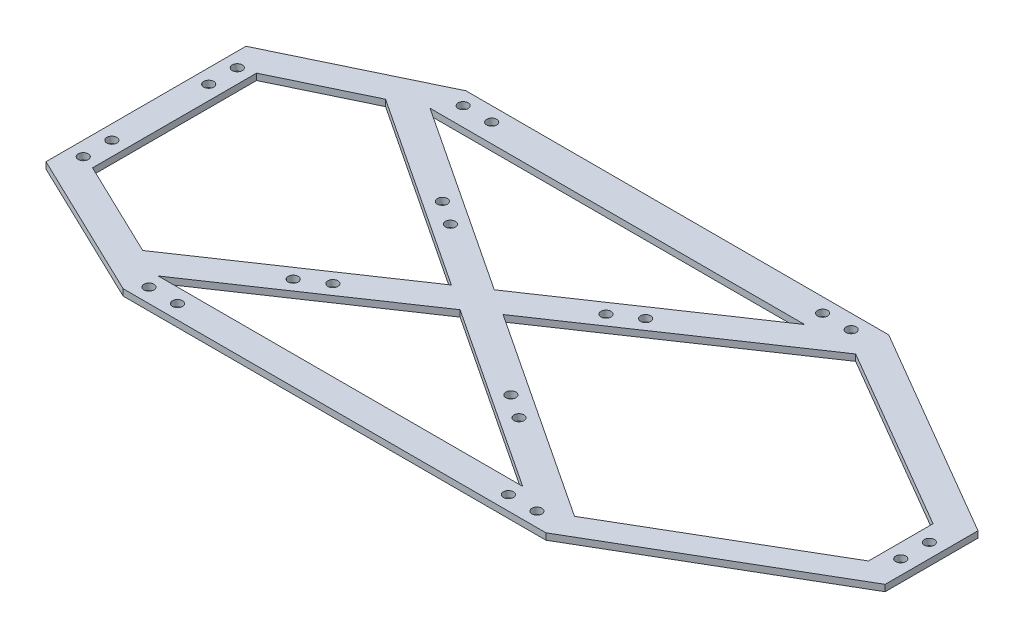
from build123d import *

# Parameters (mm, degrees)
BOSS_EXTRUDE3_DEPTH = 4.5
SKETCH2_R           = 3.5
CUT_EXTRUDE2_DEPTH  = 4.5
SKETCH3_R           = 3.5
CUT_EXTRUDE3_DEPTH  = 4.5
SKETCH4_R           = 3.5
CUT_EXTRUDE4_DEPTH  = 4.5
SKETCH5_R           = 3.5
CUT_EXTRUDE5_DEPTH  = 4.5
SKETCH6_R           = 3.5
CUT_EXTRUDE6_DEPTH  = 4.5
SKETCH7_R           = 3.5
CUT_EXTRUDE7_DEPTH  = 4.5
SKETCH8_R           = 3.5
CUT_EXTRUDE8_DEPTH  = 4.5
SKETCH9_R           = 3.5
CUT_EXTRUDE9_DEPTH  = 4.5


with BuildPart() as part:
    # Sketch1 → Boss-Extrude3 (new body)
    with BuildSketch(Plane(origin=(0, 0, 0), x_dir=(1, 0, 0), z_dir=(0, 1, 0))):
        Polygon((-400, 70), (-400, -70), (-296, -120), (0, -120), (150, -32.5), (150, 32.5), (0, 120), (-296, 120), align=None)
        Polygon((-298.002482939, 96.845926684), (-35.732646047, 96.845926684), (-165.408042798, 9.260497243), align=None, mode=Mode.SUBTRACT)
        Polygon((-380, 57.424043482), (-319.003928208, 86.749077997), (-183.349573846, -2.857581752), (-312.316233719, -89.964315732), (-380, -57.424043482), align=None, mode=Mode.SUBTRACT)
        Polygon((0, 96.845926684), (130, 21.012593351), (130, -24.166666667), (0, -100), (-147.342868955, -2.672476774), align=None, mode=Mode.SUBTRACT)
        Polygon((-36.286932906, -100), (-291.442010442, -100), (-165.284400003, -14.790555769), align=None, mode=Mode.SUBTRACT)
    extrude(amount=BOSS_EXTRUDE3_DEPTH)

    # Sketch2 → Cut-Extrude2 (cut)
    with BuildSketch(Plane(origin=(0, 4.5, 0), x_dir=(1, 0, 0), z_dir=(0, 1, 0))):
        with Locations((-36.286932906, -110)):
            Circle(SKETCH2_R)
        with Locations((-16.286932906, -110)):
            Circle(SKETCH2_R)
    cut_extrude2 = extrude(amount=-CUT_EXTRUDE2_DEPTH, mode=Mode.SUBTRACT)

    # Mirror1: Cut-Extrude2 across plane
    add(cut_extrude2.mirror(Plane.XY), mode=Mode.SUBTRACT)

    # Sketch3 → Cut-Extrude3 (cut)
    with BuildSketch(Plane(origin=(0, 4.5, 0), x_dir=(1, 0, 0), z_dir=(0, 1, 0))):
        with Locations((-267.942010442, -110)):
            Circle(SKETCH3_R)
        with Locations((-287.942010442, -110)):
            Circle(SKETCH3_R)
    cut_extrude3 = extrude(amount=-CUT_EXTRUDE3_DEPTH, mode=Mode.SUBTRACT)

    # Mirror2: Cut-Extrude3 across plane
    add(cut_extrude3.mirror(Plane.XY), mode=Mode.SUBTRACT)

    # Sketch4 → Cut-Extrude4 (cut)
    with BuildSketch(Plane(origin=(0, 4.5, 0), x_dir=(1, 0, 0), z_dir=(0, 1, 0))):
        with Locations((140, -11.577036658)):
            Circle(SKETCH4_R)
        with Locations((140, 8.422963342)):
            Circle(SKETCH4_R)
    extrude(amount=-CUT_EXTRUDE4_DEPTH, mode=Mode.SUBTRACT)

    # Sketch5 → Cut-Extrude5 (cut)
    with BuildSketch(Plane(origin=(0, 4.5, 0), x_dir=(1, 0, 0), z_dir=(0, 1, 0))):
        with Locations((-390, 33.924043482)):
            Circle(SKETCH5_R)
        with Locations((-390, 53.924043482)):
            Circle(SKETCH5_R)
    cut_extrude5 = extrude(amount=-CUT_EXTRUDE5_DEPTH, mode=Mode.SUBTRACT)

    # Mirror3: Cut-Extrude5 across plane
    add(cut_extrude5.mirror(Plane.XY), mode=Mode.SUBTRACT)

    # Sketch6 → Cut-Extrude6 (cut)
    with BuildSketch(Plane(origin=(0, 4.5, 0), x_dir=(1, 0, 0), z_dir=(0, 1, 0))):
        with Locations((-237.21688879, 44.709233314)):
            Circle(SKETCH6_R)
        with Locations((-220.528931491, 33.685981472)):
            Circle(SKETCH6_R)
    extrude(amount=-CUT_EXTRUDE6_DEPTH, mode=Mode.SUBTRACT)

    # Sketch7 → Cut-Extrude7 (cut)
    with BuildSketch(Plane(origin=(0, 4.5, 0), x_dir=(1, 0, 0), z_dir=(0, 1, 0))):
        with Locations((-242.235781203, -54.69781901)):
            Circle(SKETCH7_R)
        with Locations((-225.662040668, -43.503573852)):
            Circle(SKETCH7_R)
    extrude(amount=-CUT_EXTRUDE7_DEPTH, mode=Mode.SUBTRACT)

    # Sketch8 → Cut-Extrude8 (cut)
    with BuildSketch(Plane(origin=(0, 4.5, 0), x_dir=(1, 0, 0), z_dir=(0, 1, 0))):
        with Locations((-94.973221843, 44.766341696)):
            Circle(SKETCH8_R)
        with Locations((-111.546962379, 33.572096538)):
            Circle(SKETCH8_R)
    extrude(amount=-CUT_EXTRUDE8_DEPTH, mode=Mode.SUBTRACT)

    # Sketch9 → Cut-Extrude9 (cut)
    with BuildSketch(Plane(origin=(0, 4.5, 0), x_dir=(1, 0, 0), z_dir=(0, 1, 0))):
        with Locations((-79.183060399, -59.680217036)):
            Circle(SKETCH9_R)
        with Locations((-95.871017698, -48.656965194)):
            Circle(SKETCH9_R)
    extrude(amount=-CUT_EXTRUDE9_DEPTH, mode=Mode.SUBTRACT)


solid = part.part
